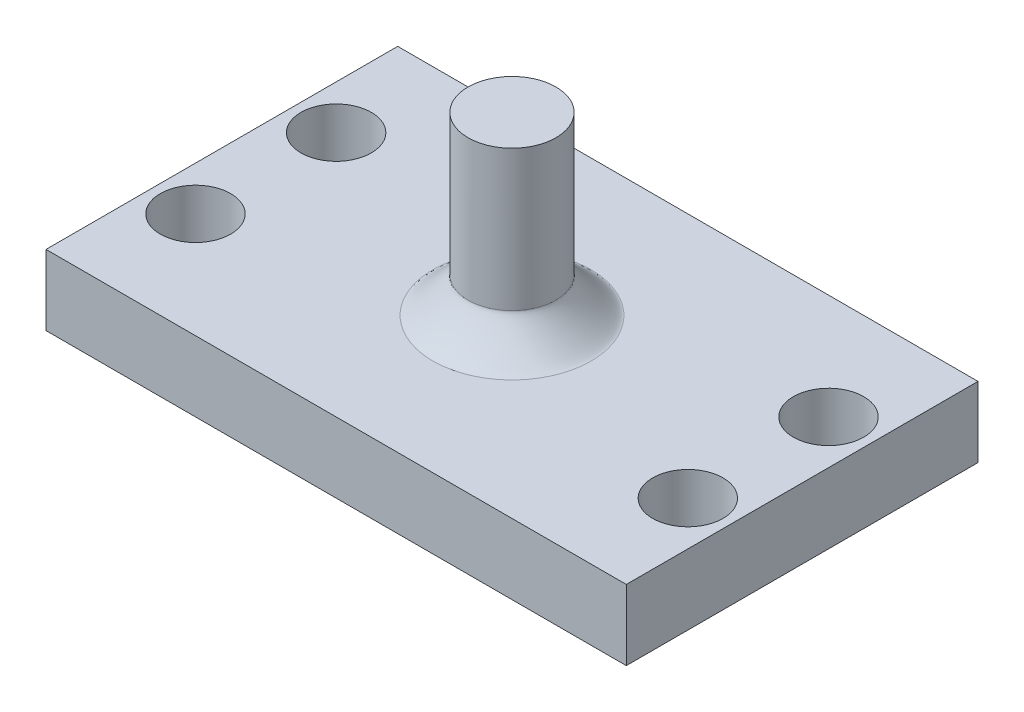
from build123d import *

# Parameters (mm, degrees)
SKETCH1_W           = 33
SKETCH1_H           = 20
BOSS_EXTRUDE1_DEPTH = 2
SKETCH2_R           = 2
CUT_EXTRUDE1_DEPTH  = 20.704060495
SKETCH3_R           = 2.5
BOSS_EXTRUDE2_DEPTH = 10
FILLET1_SIZE        = 2


with BuildPart() as part:
    # Sketch1 → Boss-Extrude1 (new, symmetric)
    with BuildSketch(Plane(origin=(0, 0, 0), x_dir=(1, 0, 0), z_dir=(0, 1, 0))):
        Rectangle(SKETCH1_W, SKETCH1_H)
    extrude(amount=BOSS_EXTRUDE1_DEPTH, both=True)

    # Sketch2 → Cut-Extrude1 (cut, through all)
    with BuildSketch(Plane(origin=(0, 2, 0), x_dir=(1, 0, 0), z_dir=(0, 1, 0))):
        with Locations(Location((-14, 4, 0), (0, 0, 270))):
            Circle(SKETCH2_R)
        with Locations(Location((-14, -4, 0), (0, 0, 270))):
            Circle(SKETCH2_R)
        with Locations(Location((14, -4, 0), (0, 0, 90))):
            Circle(SKETCH2_R)
        with Locations(Location((14, 4, 0), (0, 0, 90))):
            Circle(SKETCH2_R)
    extrude(amount=-CUT_EXTRUDE1_DEPTH, mode=Mode.SUBTRACT)

    # Sketch3 → Boss-Extrude2 (add)
    with BuildSketch(Plane(origin=(0, 2, 0), x_dir=(1, 0, 0), z_dir=(0, 1, 0))):
        with Locations(Location((0, 0, 0), (0, 0, 270))):
            Circle(SKETCH3_R)
    extrude(amount=BOSS_EXTRUDE2_DEPTH)

    # Fillet1
    # a fillet whose section is not a circle: 2 mm, written as the material it adds along each edge
    with BuildSketch(Plane(origin=(0, 2, 0), x_dir=(0, 0, 1), z_dir=(-1, 0, 0))) as fillet1_piece_1:
        with BuildLine():
            Bezier((2.5 + FILLET1_SIZE, 0), (2.5, 0), (2.5, FILLET1_SIZE), weights=[1, 0.141421356, 1])
            Line((2.5, FILLET1_SIZE), (2.5, 0))
            Line((2.5, 0), (2.5 + FILLET1_SIZE, 0))
        make_face()
    revolve(axis=Axis((0, 2, 0), (0, 1, 0)))


solid = part.part
